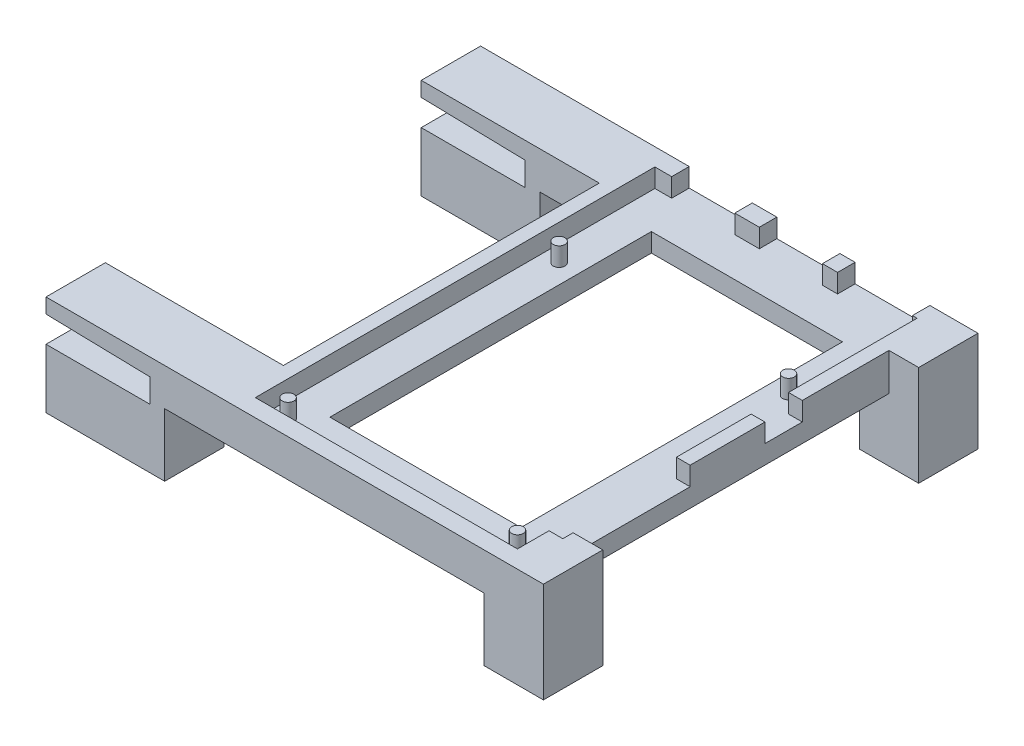
from build123d import *

# Parameters (mm, degrees)
BOSS_EXTRUDE1_DEPTH = 93
SKETCH4_W           = 38.1
SKETCH4_H           = 67.6
SKETCH4_W_2         = 6.35
CUT_EXTRUDE1_DEPTH  = 126.214866805
SKETCH5_R           = 1.25
CUT_EXTRUDE2_DEPTH  = 4
SKETCH7_W           = 40.894286244
SKETCH7_H           = 68.806910174
CUT_EXTRUDE3_DEPTH  = 125.59156821
CUT_EXTRUDE4_REACH  = 139.055
SKETCH8_W           = 67.6
SKETCH8_H           = 13.463


with BuildPart() as part:
    # Sketch1 → Boss-Extrude1 (new body)
    with BuildSketch(Plane.XY):
        Polygon((-25.4, -10.7315), (0, -10.7315), (0, 2.7315), (68.35, 2.7315), (68.35, -10.7315), (81.05, -10.7315), (81.05, 10.7315), (-25.4, 10.7315), (-25.4, 7.5565), (-3.175, 7.0485), (-3.175, 1.9685), (-25.4, 1.9685), align=None)
    extrude(amount=BOSS_EXTRUDE1_DEPTH)

    # Sketch4 → Cut-Extrude1 (cut, through all)
    with BuildSketch(Plane(origin=(0, 10.7315, 0), x_dir=(1, 0, 0), z_dir=(0, 1, 0))):
        with Locations((-6.35, -46.5)):
            Rectangle(SKETCH4_W, SKETCH4_H)
        with Locations((77.875, -46.5)):
            Rectangle(SKETCH4_W_2, SKETCH4_H)
    extrude(amount=-CUT_EXTRUDE1_DEPTH, mode=Mode.SUBTRACT)

    # Sketch5 → Cut-Extrude2 (cut)
    with BuildSketch(Plane(origin=(0, 10.7315, 0), x_dir=(1, 0, 0), z_dir=(0, 1, 0))):
        Polygon((15.65, -3.75), (15.65, -89.25), (71.75, -89.25), (71.75, -82.5), (74.7, -82.5), (74.7, -55.25), (71.75, -55.25), (71.75, -39.25), (74.7, -39.25), (74.7, -31.25), (71.75, -31.25), (71.75, -3.75), (70.75, -3.75), (70.75, 0), (54.75, 0), (54.75, -3.75), (51.5, -3.75), (51.5, 0), (38, 0), (38, -3.75), (32.75, -3.75), (32.75, 0), (19.25, 0), (19.25, -3.75), align=None)
        with Locations((68.25, -27.750007)):
            Circle(SKETCH5_R, mode=Mode.SUBTRACT)
        with Locations((19.15, -85.750007)):
            Circle(SKETCH5_R, mode=Mode.SUBTRACT)
        with Locations((68.25, -85.750007)):
            Circle(SKETCH5_R, mode=Mode.SUBTRACT)
        with Locations((19.15, -27.750007)):
            Circle(SKETCH5_R, mode=Mode.SUBTRACT)
    extrude(amount=-CUT_EXTRUDE2_DEPTH, mode=Mode.SUBTRACT)

    # Sketch7 → Cut-Extrude3 (cut, through all)
    with BuildSketch(Plane(origin=(0, 6.7315, 0), x_dir=(1, 0, 0), z_dir=(0, 1, 0))):
        with Locations((43.7, -46.5)):
            Rectangle(SKETCH7_W, SKETCH7_H)
    extrude(amount=-CUT_EXTRUDE3_DEPTH, mode=Mode.SUBTRACT)

    # Sketch8 → Cut-Extrude4 (cut, up to next)
    with BuildSketch(Plane(origin=(74.7, 0, 0), x_dir=(0, 0, -1), z_dir=(1, 0, 0)), mode=Mode.PRIVATE) as cut_extrude4_sk1:
        with Locations((-46.5, -4)):
            Rectangle(SKETCH8_W, SKETCH8_H)
    cut_extrude4_tool1 = extrude(cut_extrude4_sk1.sketch, amount=-CUT_EXTRUDE4_REACH, mode=Mode.PRIVATE) & part.part
    add(cut_extrude4_tool1.solids().sort_by_distance((74.7, -4, 46.5))[0], mode=Mode.SUBTRACT)


solid = part.part
